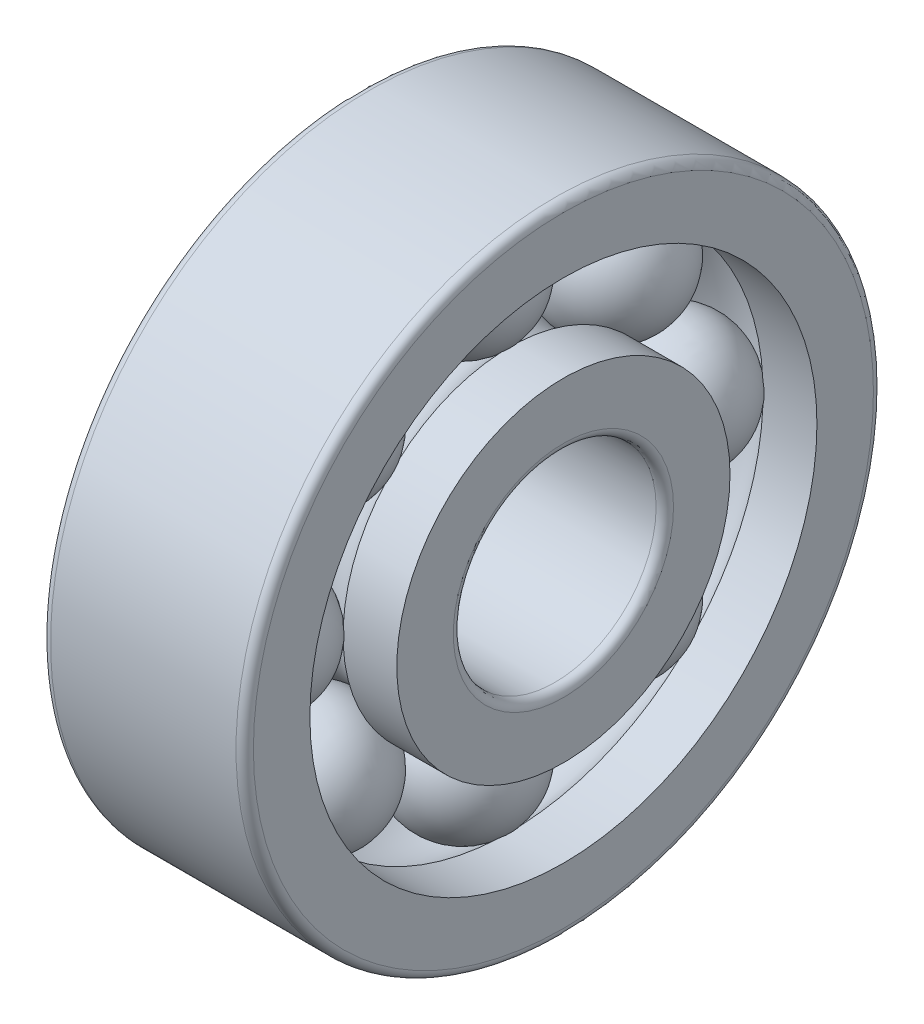
from build123d import *

# Parameters (mm, degrees)
CAGSPISKE_W         = 0.45
CAGSPISKE_H         = 0.75
CAGESPINE_ANGLE     = 0.001
BALLSDETAILED_COUNT = 8
BALLSDETAILED_ANGLE = 315


with BuildPart() as part:
    # CagSpiSke → CageSpine (revolve)
    with BuildSketch(Plane.XY):
        with Locations((0, 7.25)):
            Rectangle(CAGSPISKE_W, CAGSPISKE_H)
    revolve(axis=Axis((-20.6375, 0, 0), (-1, 0, 0)), revolution_arc=CAGESPINE_ANGLE)

    # BalDetSke → BallDetailed (revolve)
    with BuildSketch(Plane.XY):
        with BuildLine():
            Line((-2.25, 7.25), (2.25, 7.25))
            ThreePointArc((2.25, 7.25), (0, 5), (-2.25, 7.25))
        make_face()
    balldetailed = revolve(axis=Axis((-1.905, 7.25, 0), (1, 0, 0)))

    # InnRacSke → InnerRace (revolve)
    with BuildSketch(Plane.XY):
        with BuildLine():
            Line((-1.643357843, 5.75), (-3.5, 5.75))
            Line((-3.5, 5.75), (-3.5, 3.8))
            ThreePointArc((-3.5, 3.8), (-3.412132034, 3.587867966), (-3.2, 3.5))
            Line((-3.2, 3.5), (3.2, 3.5))
            ThreePointArc((3.2, 3.5), (3.412132034, 3.587867966), (3.5, 3.8))
            Line((3.5, 3.8), (3.5, 5.75))
            Line((3.5, 5.75), (1.643357843, 5.75))
            ThreePointArc((1.643357843, 5.75), (0, 5.025), (-1.643357843, 5.75))
        make_face()
    revolve(axis=Axis((-20.6375, 0, 0), (1, 0, 0)))

    # OutRacSke → OuterRace (revolve)
    with BuildSketch(Plane.XY):
        with BuildLine():
            Line((-1.643357843, 8.75), (-3.5, 8.75))
            Line((-3.5, 8.75), (-3.5, 10.7))
            ThreePointArc((-3.5, 10.7), (-3.412132034, 10.912132034), (-3.2, 11))
            Line((-3.2, 11), (3.2, 11))
            ThreePointArc((3.2, 11), (3.412132034, 10.912132034), (3.5, 10.7))
            Line((3.5, 10.7), (3.5, 8.75))
            Line((3.5, 8.75), (1.643357843, 8.75))
            ThreePointArc((1.643357843, 8.75), (0, 9.475), (-1.643357843, 8.75))
        make_face()
    revolve(axis=Axis((-20.6375, 0, 0), (1, 0, 0)))

    # BallsDetailed: BallDetailed ×8 about axis
    ballsdetailed_axis = Axis((-50, 0, 0), (1, 0, 0))
    for i in range(1, BALLSDETAILED_COUNT):
        add(balldetailed.rotate(ballsdetailed_axis, i * BALLSDETAILED_ANGLE / (BALLSDETAILED_COUNT - 1)))


solid = part.part
